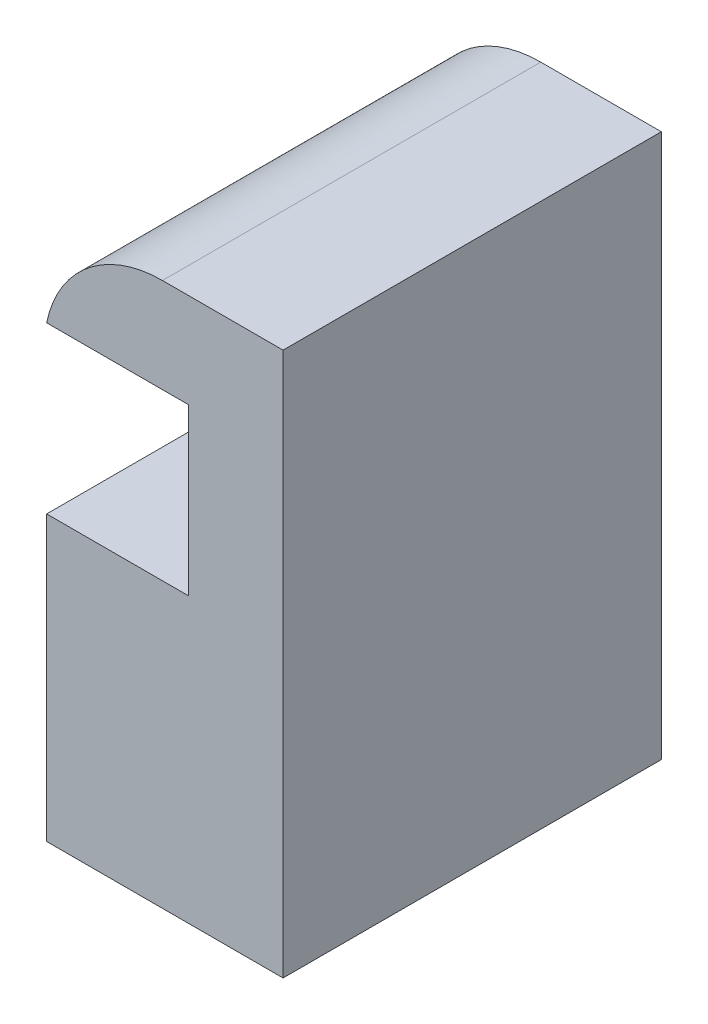
from build123d import *

# Parameters (mm, degrees)
BOSS_EXTRUDE1_DEPTH = 16
FILLET1_R           = 5


with BuildPart() as part:
    # Sketch1 → Boss-Extrude1 (new body)
    with BuildSketch(Plane.XY):
        Polygon((0, 0), (10, 0), (10, 23), (0, 23), (0, 19), (6, 19), (6, 12), (0, 12), align=None)
    extrude(amount=BOSS_EXTRUDE1_DEPTH)

    # Fillet1
    # the kernel refuses this fillet: 5 mm, written as the material it takes off along each edge
    with BuildSketch(Plane(origin=(0, 23, -12.247448714), x_dir=(1, 0, 0), z_dir=(0, 0, 1))) as fillet1_piece_1:
        with BuildLine():
            CenterArc((4.898979486, -5), FILLET1_R, 90, 78.463040967)
            Line((0, -4), (-0.09797959, -3.98))
            ThreePointArc((-0.09797959, -3.98), (-0.1, -2), (-0.1, 0))
            Line((-0.1, 0), (0, 0.1))
            Line((0, 0.1), (4.898979486, 0.1))
            Line((4.898979486, 0.1), (4.898979486, 0))
        make_face()
    extrude(amount=40.494897428, mode=Mode.SUBTRACT)


solid = part.part
